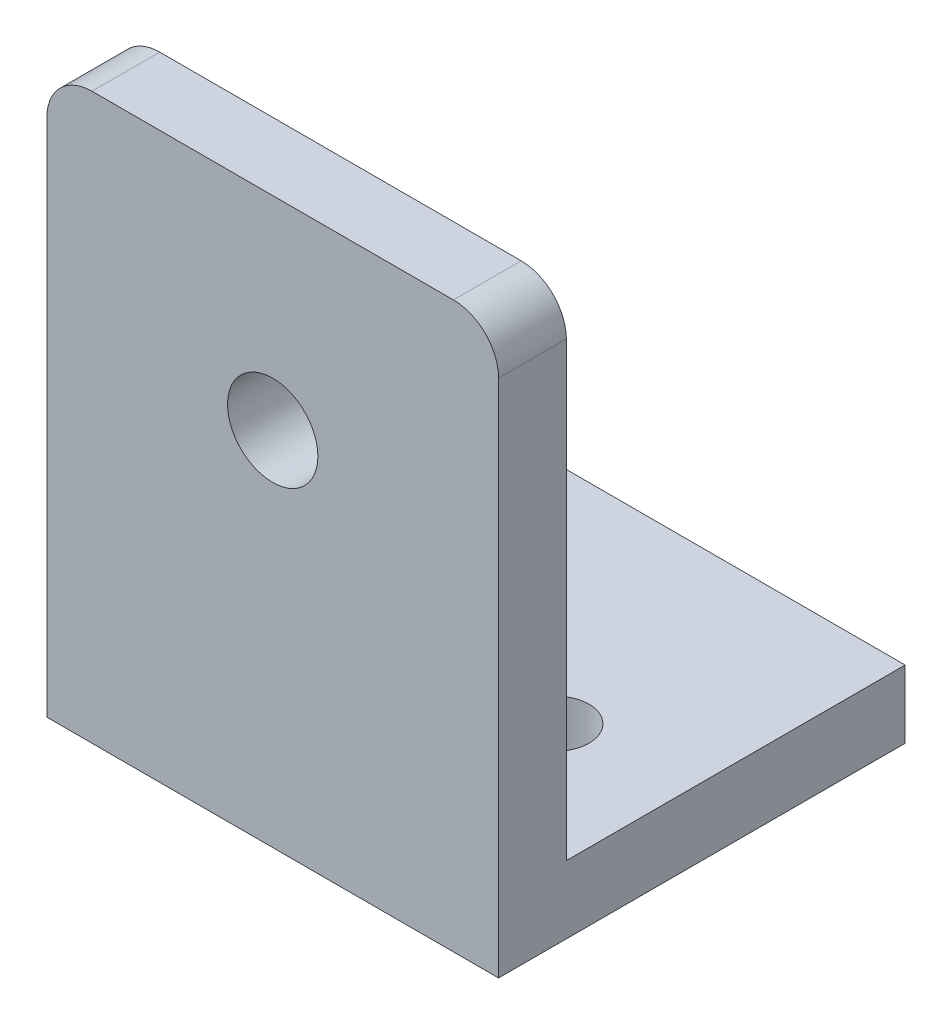
from build123d import *

# Parameters (mm, degrees)
EXTRUDE_1_DEPTH     = 20
SKETCH_2_R          = 1.5
CUT_EXTRUDE_1_DEPTH = 35.756294394
FILLET_1_R          = 2
SKETCH_3_R          = 2
CUT_EXTRUDE_2_DEPTH = 37.728735344


with BuildPart() as part:
    # 草图1 → 凸台-拉伸1 (new body)
    with BuildSketch(Plane(origin=(0, 0, 0), x_dir=(0, 0, -1), z_dir=(1, 0, 0))):
        Polygon((0, 0), (0, 25), (3, 25), (3, 3), (18, 3), (18, 0), align=None)
    extrude(amount=EXTRUDE_1_DEPTH)

    # 草图2 → 切除-拉伸1 (cut, through all)
    with BuildSketch(Plane(origin=(0, 3, 0), x_dir=(1, 0, 0), z_dir=(0, 1, 0))):
        with Locations((5.5, 8)):
            Circle(SKETCH_2_R)
        with Locations((14.5, 8)):
            Circle(SKETCH_2_R)
    extrude(amount=-CUT_EXTRUDE_1_DEPTH, mode=Mode.SUBTRACT)

    # 圆角1
    fillet_1_edges = [part.edges().sort_by_distance(p)[0] for p in [
        (0, 25, -1.5),
        (20, 25, -1.5),
    ]]
    fillet(fillet_1_edges, radius=FILLET_1_R)

    # 草图3 → 切除-拉伸2 (cut, through all)
    with BuildSketch(Plane.XY):
        with Locations((10, 16)):
            Circle(SKETCH_3_R)
    extrude(amount=-CUT_EXTRUDE_2_DEPTH, mode=Mode.SUBTRACT)


solid = part.part
